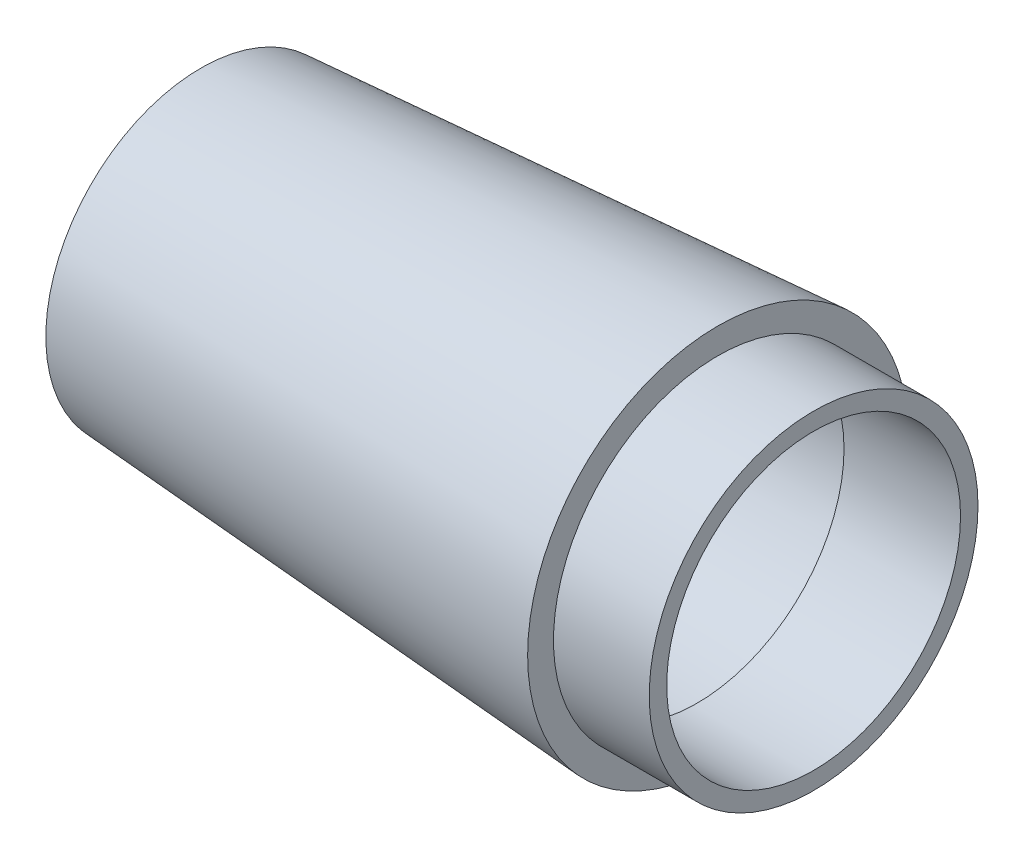
from build123d import *

# Parameters (mm, degrees)
SKETCH2_W      = 0.625748312
SKETCH2_H      = 0.221900722
REVOLVE5_ANGLE = 180


with BuildPart() as part:
    # Sketch1 → Revolve4 (revolve)
    with BuildSketch(Plane.XY):
        Polygon((-12.065, 7.62), (-12.065, 6.35), (-0.881912621, 7.110449942), (-0.881912621, 0), (0.635, 0), (0.635, 7.2136), (12.315139743, 8.007849503), (12.315139743, 7.219097863), (18.039716089, 7.219097863), (18.039716089, 8.0772), (13.335, 8.0772), (13.335, 9.3472), align=None)
    revolve(axis=Axis((44.726440805, 0, 0), (-1, 0, 0)))

    # Sketch2 → Revolve5 (revolve)
    with BuildSketch(Plane(origin=(0.635, 0, 0), x_dir=(0, 0, -1), z_dir=(1, 0, 0))):
        with Locations((0, 0.897225516)):
            Rectangle(SKETCH2_W, SKETCH2_H)
    revolve(axis=Axis((0.635, 0, 0.312874156), (0, 0, -1)), revolution_arc=REVOLVE5_ANGLE)


solid = part.part
